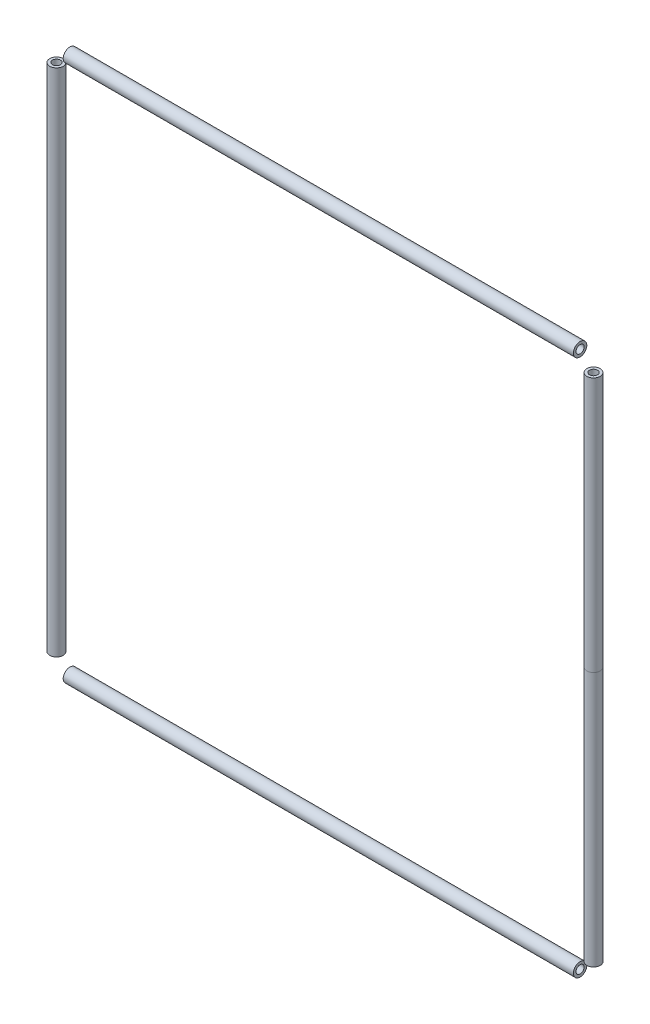
from build123d import *

# Parameters (mm, degrees)
SKETCH3_R               = 3.175
SKETCH3_R_2             = 1.905
CUT_EXTRUDE1_DEPTH      = 185.122627276
CUT_EXTRUDE1_DEPTH_BACK = 185.122627276
SKETCH4_W               = 12.7
SKETCH4_H               = 12.7


with BuildPart() as part:
    # Sweep1: sweep along a path in Sketch1
    with BuildLine(Plane.XY) as sweep1_path:
        Line((-127, 127), (127, 127))
        Line((127, 127), (127, -127))
        Line((127, -127), (-127, -127))
        Line((-127, -127), (-127, 127))
    # Sketch3 → Sweep1 (sweep)
    with BuildSketch(Plane(origin=(0, 0, 0), x_dir=(1, 0, 0), z_dir=(0, 1, 0))):
        with Locations((127, 0)):
            Circle(SKETCH3_R)
        with Locations((127, 0)):
            Circle(SKETCH3_R_2, mode=Mode.SUBTRACT)
    sweep(path=sweep1_path.line, transition=Transition.RIGHT)

    # Sketch4 → Cut-Extrude1 (cut, two sides: drawn at the far end of the back side and taken through both)
    with BuildSketch(Plane.XY.offset(-CUT_EXTRUDE1_DEPTH_BACK)):
        with Locations((127, 127)):
            Rectangle(SKETCH4_W, SKETCH4_H)
        with Locations((-127, 127)):
            Rectangle(SKETCH4_W, SKETCH4_H)
        with Locations((-127, -127)):
            Rectangle(SKETCH4_W, SKETCH4_H)
        with Locations((127, -127)):
            Rectangle(SKETCH4_W, SKETCH4_H)
    extrude(amount=CUT_EXTRUDE1_DEPTH + CUT_EXTRUDE1_DEPTH_BACK, mode=Mode.SUBTRACT)


with BuildPart() as cut_extrude1_piece_1:
    # of the separate pieces the step leaves, piece 1, a body of its own (cut_extrude1_pieces)
    add(part.part.solids().sort_by_distance((-120.65, 130.175, 0))[0])


with BuildPart() as cut_extrude1_piece_2:
    # of the separate pieces the step leaves, piece 2, a body of its own (cut_extrude1_pieces)
    add(part.part.solids().sort_by_distance((-130.175, -120.65, 0))[0])


with BuildPart() as cut_extrude1_piece_3:
    # of the separate pieces the step leaves, piece 3, a body of its own (cut_extrude1_pieces)
    add(part.part.solids().sort_by_distance((130.175, 120.65, 0))[0])


with BuildPart() as cut_extrude1_piece_4:
    # of the separate pieces the step leaves, piece 4, a body of its own (cut_extrude1_pieces)
    add(part.part.solids().sort_by_distance((120.65, -130.175, 0))[0])


solid = Compound([cut_extrude1_piece_1.part, cut_extrude1_piece_2.part, cut_extrude1_piece_3.part, cut_extrude1_piece_4.part])
